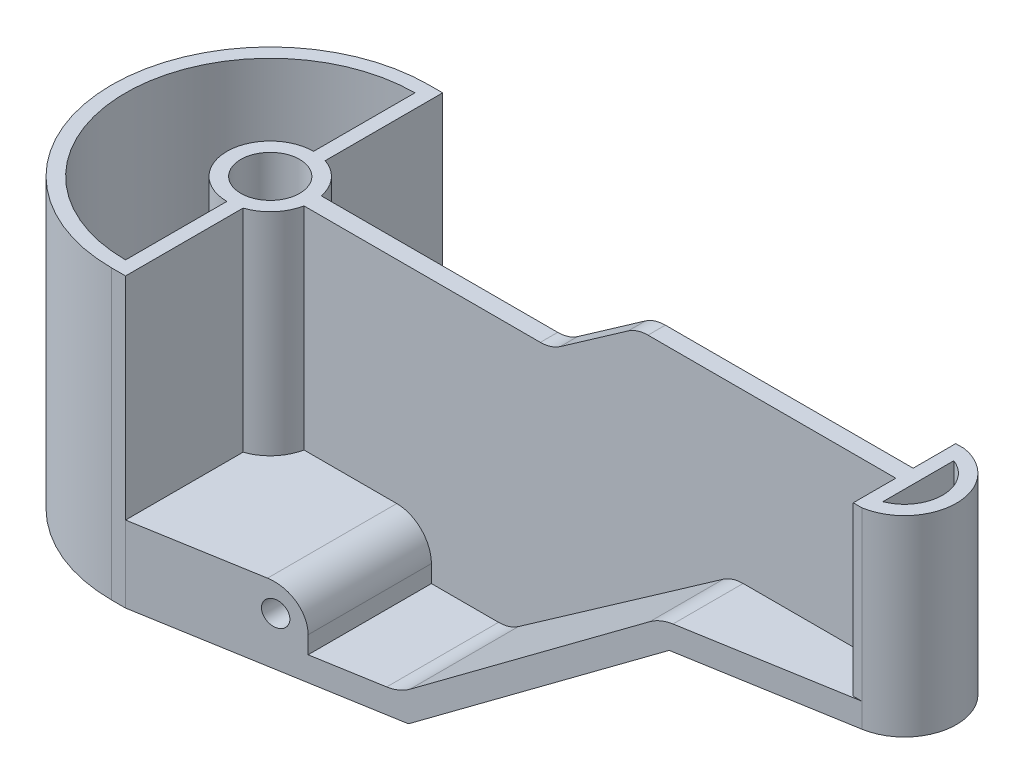
from build123d import *

# Parameters (mm, degrees)
BOSS_EXTRUDE1_DEPTH     = 200
BOSS_EXTRUDE2_DEPTH     = 200
BOSS_EXTRUDE3_START     = 76
SKETCH4_R               = 8.5
BOSS_EXTRUDE3_DEPTH     = 83
BOSS_EXTRUDE4_START     = 48.333333333
BOSS_EXTRUDE4_DEPTH     = 55.333333333
RIB1_START              = -2.5
RIB1_DEPTH              = 5
FILLET3_R               = 10
SKETCH9_R               = 3.5
BOSS_EXTRUDE6_DEPTH     = 50
CUT_EXTRUDE3_DEPTH      = 244.455905202
CUT_EXTRUDE3_DEPTH_BACK = 244.455905202
SKETCH10_R              = 3.5
CUT_EXTRUDE4_DEPTH      = 219.723823831
CUT_EXTRUDE4_DEPTH_BACK = 219.723823831
CUT_EXTRUDE2_DEPTH      = 220.51323992
CUT_EXTRUDE2_DEPTH_BACK = 220.51323992
SKETCH7_R               = 8.5


# Read off the part's stored shape, not the designer's step: Rib1
with BuildPart() as part:
    # Sketch1 → Boss-Extrude1 (new, symmetric)
    with BuildSketch(Plane(origin=(0, 0, 0), x_dir=(1, 0, 0), z_dir=(0, 1, 0))):
        with BuildLine():
            Line((0, 45.75), (4, 45.75))
            Line((4, 45.75), (185.522228719, 14.786424933))
            ThreePointArc((185.522228719, 14.786424933), (198, 0), (185.522228719, -14.786424933))
            Line((185.522228719, -14.786424933), (4, -45.75))
            Line((4, -45.75), (0, -45.75))
            ThreePointArc((0, -45.75), (-45.75, 0), (0, 45.75))
        make_face()
    extrude(amount=BOSS_EXTRUDE1_DEPTH, both=True)


with BuildPart() as body_2:
    # Sketch3 → Boss-Extrude2 (new, symmetric)
    with BuildSketch(Plane.XY):
        Polygon((-45.75, 0), (73.733339697, 0), (138, 45), (198, 45), (198, 52), (135.792908478, 52), (71.526248174, 7), (-45.75, 7), align=None)
    extrude(amount=BOSS_EXTRUDE2_DEPTH, both=True)


with BuildPart() as part_1:
    add(part.part)

    # Combine1: intersect body 2
    add(body_2.part, mode=Mode.INTERSECT)

    # Sketch4 → Boss-Extrude3 (add)
    with BuildSketch(Plane(origin=(0, 7, 0), x_dir=(1, 0, 0), z_dir=(0, 1, 0)).offset(BOSS_EXTRUDE3_START)):
        with BuildLine():
            Line((0, -45.75), (4, -45.75))
            Line((4, -45.75), (4, -11.842719282))
            ThreePointArc((4, -11.842719282), (12.5, 0), (4, 11.842719282))
            Line((4, 11.842719282), (4, 45.75))
            Line((4, 45.75), (0, 45.75))
            ThreePointArc((0, 45.75), (-45.75, 0), (0, -45.75))
        make_face()
        with Locations(Location((0, 0, 0), (0, 0, 270))):
            Circle(SKETCH4_R, mode=Mode.SUBTRACT)
        with BuildLine():
            Line((0, -41.75), (0, -12.5))
            ThreePointArc((0, -12.5), (-12.5, 0), (0, 12.5))
            Line((0, 12.5), (0, 41.75))
            ThreePointArc((0, 41.75), (-41.75, 0), (0, -41.75))
        make_face(mode=Mode.SUBTRACT)
    extrude(amount=-BOSS_EXTRUDE3_DEPTH)

    # Sketch5 → Boss-Extrude4 (add)
    with BuildSketch(Plane(origin=(0, 52, 0), x_dir=(1, 0, 0), z_dir=(0, 1, 0)).offset(BOSS_EXTRUDE4_START)):
        with BuildLine():
            Line((185.522228719, -14.786424933), (183, -14.786424933))
            Line((183, -14.786424933), (183, 14.786424933))
            Line((183, 14.786424933), (185.522228719, 14.786424933))
            ThreePointArc((185.522228719, 14.786424933), (198, 0), (185.522228719, -14.786424933))
        make_face()
        with BuildLine():
            Line((187, -10.246950766), (187, 10.246950766))
            ThreePointArc((187, 10.246950766), (194, 0), (187, -10.246950766))
        make_face(mode=Mode.SUBTRACT)
    extrude(amount=-BOSS_EXTRUDE4_DEPTH)

    # Rib1 outline → Rib1 (add)
    with BuildSketch(Plane.XY.offset(RIB1_START)):
        Polygon((108.349339446, 100.333333333), (83.594773996, 83), (11, 83), (11, 7), (71.526248174, 7), (135.792908478, 52), (183, 52), (183, 100.333333333), align=None)
    extrude(amount=RIB1_DEPTH)

    # Fillet3
    fillet3_edges = [part_1.edges().sort_by_distance(p)[0] for p in [
        (135.792908478, 52, -12.884559521),
        (71.526248174, 7, -18.365776821),
        (108.349339446, 100.333333333, 0),
        (83.594773996, 83, 0),
        (135.792908478, 52, 12.884559521),
        (71.526248174, 7, 18.365776821),
    ]]
    fillet(fillet3_edges, radius=FILLET3_R)

    # Sketch9 → Boss-Extrude6 (add, symmetric)
    with BuildSketch(Plane.XY):
        with BuildLine():
            Line((4, 7), (4, 22))
            Line((4, 22), (39, 22))
            ThreePointArc((39, 22), (46.071067812, 19.071067812), (49, 12))
            Line((49, 12), (49, 7))
            Line((49, 7), (4, 7))
        make_face()
        with Locations((41, 14)):
            Circle(SKETCH9_R, mode=Mode.SUBTRACT)
    extrude(amount=BOSS_EXTRUDE6_DEPTH, both=True)

    # Sketch10 → Cut-Extrude3 (cut, two sides: drawn at the far end of the back side and taken through both)
    with BuildSketch(Plane.XY.offset(50).offset(-CUT_EXTRUDE3_DEPTH_BACK)):
        with Locations((41, 14)):
            Circle(SKETCH10_R)
    extrude(amount=CUT_EXTRUDE3_DEPTH + CUT_EXTRUDE3_DEPTH_BACK, mode=Mode.SUBTRACT)

    # Sketch11 → Cut-Extrude4 (cut, two sides: drawn at the far end of the back side and taken through both)
    with BuildSketch(Plane(origin=(0, 22, 0), x_dir=(1, 0, 0), z_dir=(0, 1, 0)).offset(-CUT_EXTRUDE4_DEPTH_BACK)):
        Polygon((4, -45.75), (49, -38.074020657), (49, -50), (4, -50), align=None)
        Polygon((4, 45.75), (49, 38.074020657), (49, 50), (4, 50), align=None)
    extrude(amount=CUT_EXTRUDE4_DEPTH + CUT_EXTRUDE4_DEPTH_BACK, mode=Mode.SUBTRACT)

    # Sketch7 → Cut-Extrude2 (cut, two sides: drawn at the far end of the back side and taken through both)
    with BuildSketch(Plane(origin=(0, 83, 0), x_dir=(1, 0, 0), z_dir=(0, 1, 0)).offset(-CUT_EXTRUDE2_DEPTH_BACK)):
        with Locations(Location((0, 0, 0), (0, 0, 270))):
            Circle(SKETCH7_R)
        with BuildLine():
            Line((187, 10.246950766), (187, -10.246950766))
            ThreePointArc((187, -10.246950766), (194, 0), (187, 10.246950766))
        make_face()
        with BuildLine():
            Line((0, 12.5), (0, 41.75))
            ThreePointArc((0, 41.75), (-41.75, 0), (0, -41.75))
            Line((0, -41.75), (0, -12.5))
            ThreePointArc((0, -12.5), (-12.5, 0), (0, 12.5))
        make_face()
    extrude(amount=CUT_EXTRUDE2_DEPTH + CUT_EXTRUDE2_DEPTH_BACK, mode=Mode.SUBTRACT)


solid = part_1.part
